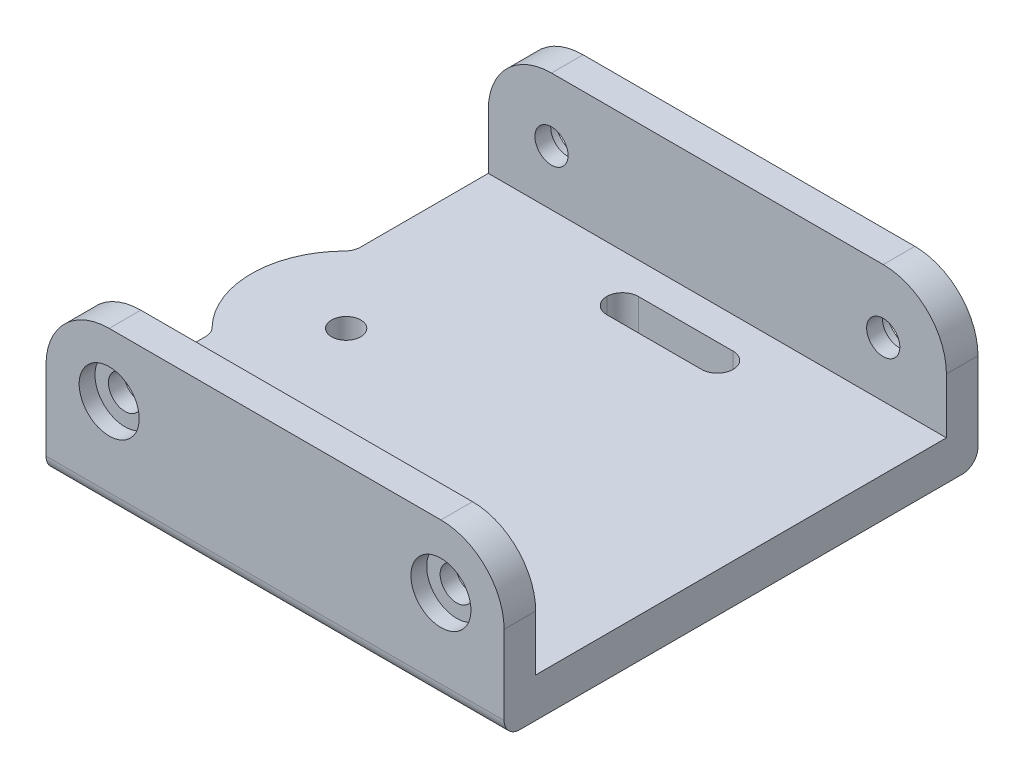
from build123d import *

# Parameters (mm, degrees)
EXTRUDE_1_DEPTH              = 14.5
HOLE_START                   = -15
HOLE_WIZARD_M2_1_OUTLINE_R   = 1.9
HOLE_WIZARD_M2_1_DEPTH       = 1
HOLE_START_2                 = -14
HOLE_WIZARD_M2_1_2_OUTLINE_R = 1.05
HOLE_WIZARD_M2_1_2_DEPTH     = 1
SKETCH_5_R                   = 6
EXTRUDE_2_DEPTH              = 2.5
SKETCH_6_R                   = 3.5
EXTRUDE_3_DEPTH              = 2
CHAMFER_1_SIZE               = 0.5
CUT_EXTRUDE_1_REACH          = 27.323
SKETCH_7_R                   = 0.925
FILLET_1_R                   = 4
FILLET_2_R                   = 1
CUT_EXTRUDE_2_REACH          = 26.439
SKETCH_8_W                   = 8
SKETCH_8_H                   = 2
FILLET_3_R                   = 1


# Read off the part's stored shape, not the designer's step: M2 丸平ねじ用座ぐり穴1
with BuildPart() as part:
    # ｽｹｯﾁ1 → ﾎﾞｽ - 押し出し1 (new, symmetric)
    with BuildSketch(Plane(origin=(0, 0, 0), x_dir=(0, 0, -1), z_dir=(1, 0, 0))):
        Polygon((-15, -5), (15, -5), (15, 5), (13, 5), (13, -2.5), (-13, -2.5), (-13, 5), (-15, 5), align=None)
    extrude(amount=EXTRUDE_1_DEPTH, both=True)

    # M2 丸平ねじ用座ぐり穴1 outline → M2 丸平ねじ用座ぐり穴1 (cut)
    with BuildSketch(Plane.XY.offset(HOLE_START)):
        with Locations((-10.5, 1)):
            Circle(HOLE_WIZARD_M2_1_OUTLINE_R)
        with Locations((10.5, 1)):
            Circle(HOLE_WIZARD_M2_1_OUTLINE_R)
    hole_wizard_m2_1 = extrude(amount=HOLE_WIZARD_M2_1_DEPTH, mode=Mode.SUBTRACT)

    # Hole Wizard M2 _1 2 outline → Hole Wizard M2 _1 2 (cut)
    with BuildSketch(Plane.XY.offset(HOLE_START_2)):
        with Locations((-10.5, 1)):
            Circle(HOLE_WIZARD_M2_1_2_OUTLINE_R)
        with Locations((10.5, 1)):
            Circle(HOLE_WIZARD_M2_1_2_OUTLINE_R)
    hole_wizard_m2_1_2 = extrude(amount=HOLE_WIZARD_M2_1_2_DEPTH, mode=Mode.SUBTRACT)

    # ｽｹｯﾁ5 → ﾎﾞｽ - 押し出し2 (add)
    with BuildSketch(Plane.XZ.offset(5)):
        with Locations((-10.5, 0)):
            Circle(SKETCH_5_R)
    extrude(amount=-EXTRUDE_2_DEPTH)

    # ｽｹｯﾁ6 → ﾎﾞｽ - 押し出し3 (add)
    with BuildSketch(Plane.XZ.offset(5)):
        with Locations(Location((-10.5, 0, 0), (0, 0, 90))):
            Circle(SKETCH_6_R)
    extrude(amount=EXTRUDE_3_DEPTH)

    # 面取り1
    chamfer_1_edges = [part.edges().sort_by_distance(p)[0] for p in [
        (-10.5, -7, -3.5),
    ]]
    chamfer(chamfer_1_edges, length=CHAMFER_1_SIZE)

    # ｽｹｯﾁ7 → ｶｯﾄ - 押し出し1 (cut, up to next)
    with BuildSketch(Plane.XZ.offset(7), mode=Mode.PRIVATE) as cut_extrude_1_sk1:
        with Locations(Location((-10.5, 0, 0), (0, 0, 270))):
            Circle(SKETCH_7_R)
    cut_extrude_1_tool1 = extrude(cut_extrude_1_sk1.sketch, amount=-CUT_EXTRUDE_1_REACH, mode=Mode.PRIVATE) & part.part
    add(cut_extrude_1_tool1.solids().sort_by_distance((-10.5, -7, 0))[0], mode=Mode.SUBTRACT)

    # ﾌｨﾚｯﾄ1
    fillet_1_edges = [part.edges().sort_by_distance(p)[0] for p in [
        (-14.5, 5, 14),
        (14.5, 5, -14),
        (14.5, 5, 14),
        (-14.5, 5, -14),
    ]]
    fillet(fillet_1_edges, radius=FILLET_1_R)

    # ﾌｨﾚｯﾄ2
    fillet_2_edges = [part.edges().sort_by_distance(p)[0] for p in [
        (0, -5, -15),
        (0, -5, 15),
        (-14.5, -3.75, -4.472135955),
        (-14.5, -3.75, 4.472135955),
    ]]
    fillet(fillet_2_edges, radius=FILLET_2_R)

    # ｽｹｯﾁ8 → ｶｯﾄ - 押し出し2 (cut, up to next)
    with BuildSketch(Plane.XZ.offset(5), mode=Mode.PRIVATE) as cut_extrude_2_sk1:
        with Locations((0, -10)):
            Rectangle(SKETCH_8_W, SKETCH_8_H)
    cut_extrude_2_tool1 = extrude(cut_extrude_2_sk1.sketch, amount=-CUT_EXTRUDE_2_REACH, mode=Mode.PRIVATE) & part.part
    add(cut_extrude_2_tool1.solids().sort_by_distance((0, -5, -10))[0], mode=Mode.SUBTRACT)

    # ﾌｨﾚｯﾄ3
    fillet_3_edges = [part.edges().sort_by_distance(p)[0] for p in [
        (4, -3.75, -9),
        (-4, -3.75, -9),
        (-4, -3.75, -11),
        (4, -3.75, -11),
    ]]
    fillet(fillet_3_edges, radius=FILLET_3_R - 0.0001)  # a hair under: the kernel refuses the full size

    # ﾐﾗｰ1: M2 丸平ねじ用座ぐり穴1, Hole Wizard M2 _1 2 across plane
    add(hole_wizard_m2_1.mirror(Plane.XY), mode=Mode.SUBTRACT)
    add(hole_wizard_m2_1_2.mirror(Plane.XY), mode=Mode.SUBTRACT)


solid = part.part
